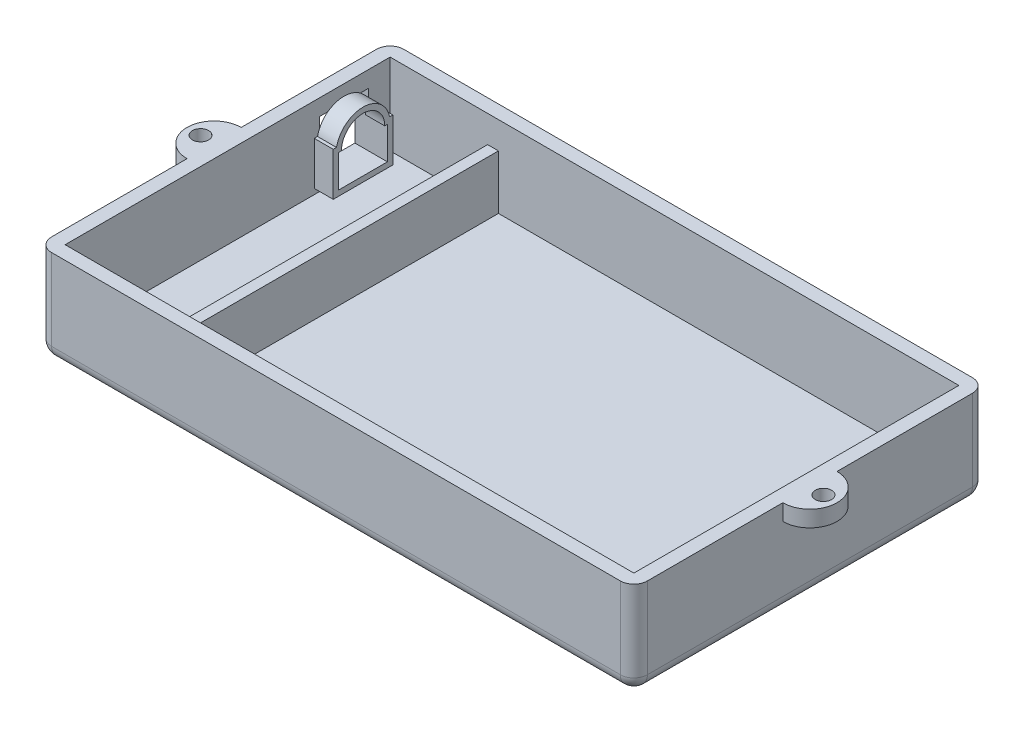
from build123d import *

# Parameters (mm, degrees)
SKETCH1_W           = 105
SKETCH1_H           = 60
BOSS_EXTRUDE1_DEPTH = 15
SHELL1_T            = 2.5
FILLET1_R           = 2.5
SKETCH3_R           = 1.5
BOSS_EXTRUDE2_DEPTH = 3
SKETCH4_W           = 2
SKETCH4_H           = 60
BOSS_EXTRUDE3_DEPTH = 10
BOSS_EXTRUDE4_DEPTH = 6
SKETCH7_W           = 9
SKETCH7_H           = 10
CUT_EXTRUDE1_DEPTH  = 2.5


with BuildPart() as part:
    # Sketch1 → Boss-Extrude1 (new body)
    with BuildSketch(Plane(origin=(0, 0, 0), x_dir=(1, 0, 0), z_dir=(0, 1, 0))):
        Rectangle(SKETCH1_W, SKETCH1_H)
    extrude(amount=BOSS_EXTRUDE1_DEPTH)

    # Shell1
    shell1_openings = [part.faces().sort_by_distance(p)[0] for p in [
        (0, 15, 0),
    ]]
    offset(amount=SHELL1_T, openings=shell1_openings, kind=Kind.INTERSECTION)

    # Fillet1
    # the kernel refuses this fillet: 2.5 mm, written as the material it takes off along each edge
    with BuildSketch(Plane(origin=(52.5, 0, -30), x_dir=(1, 0, 0), z_dir=(0, 0, -1))) as fillet1_piece_1_section:
        Polygon((0, 0), (FILLET1_R, 0), (FILLET1_R, FILLET1_R), (0, FILLET1_R), align=None)
    fillet1_piece_1 = extrude(amount=FILLET1_R, mode=Mode.PRIVATE)
    fillet1_piece_1 = fillet1_piece_1 - Plane(origin=(52.5, 0, -30), x_dir=(-0.7071067811865475, 0.7071067811865475, 0), z_dir=(0, 0, -1)) * Sphere(FILLET1_R, mode=Mode.PRIVATE)
    add(fillet1_piece_1, mode=Mode.SUBTRACT)
    with BuildSketch(Plane(origin=(-52.5, 0, -30), x_dir=(0, -1, 0), z_dir=(0, 0, -1))) as fillet1_piece_2_section:
        Polygon((0, 0), (FILLET1_R, 0), (FILLET1_R, FILLET1_R), (0, FILLET1_R), align=None)
    fillet1_piece_2 = extrude(amount=FILLET1_R, mode=Mode.PRIVATE)
    fillet1_piece_2 = fillet1_piece_2 - Plane(origin=(-52.5, 0, -30), x_dir=(0.7071067811865475, 0.7071067811865475, 0), z_dir=(0, 0, -1)) * Sphere(FILLET1_R, mode=Mode.PRIVATE)
    add(fillet1_piece_2, mode=Mode.SUBTRACT)
    with BuildSketch(Plane(origin=(52.5, 0, 30), x_dir=(0, -1, 0), z_dir=(1, 0, 0))) as fillet1_piece_3_section:
        Polygon((0, 0), (FILLET1_R, 0), (FILLET1_R, -FILLET1_R), (0, -FILLET1_R), align=None)
    fillet1_piece_3 = extrude(amount=FILLET1_R, mode=Mode.PRIVATE)
    fillet1_piece_3 = fillet1_piece_3 - Plane(origin=(52.5, 0, 30), x_dir=(0, 0.7071067811865475, -0.7071067811865475), z_dir=(1, 0, 0)) * Sphere(FILLET1_R, mode=Mode.PRIVATE)
    add(fillet1_piece_3, mode=Mode.SUBTRACT)
    with BuildSketch(Plane(origin=(-52.5, 0, 30), x_dir=(0, 0, 1), z_dir=(0, -1, 0))) as fillet1_piece_4_section:
        Polygon((0, 0), (FILLET1_R, 0), (FILLET1_R, FILLET1_R), (0, FILLET1_R), align=None)
    fillet1_piece_4 = extrude(amount=FILLET1_R, mode=Mode.PRIVATE)
    fillet1_piece_4 = fillet1_piece_4 - Plane(origin=(-52.5, 0, 30), x_dir=(0.7071067811865475, 0, -0.7071067811865476), z_dir=(0, -1, 0)) * Sphere(FILLET1_R, mode=Mode.PRIVATE)
    add(fillet1_piece_4, mode=Mode.SUBTRACT)
    with BuildSketch(Plane(origin=(52.5, -2.5, -32.5), x_dir=(0, 1, 0), z_dir=(-1, 0, 0)), Plane(origin=(-52.5, -2.5, 32.5), x_dir=(0, 1, 0), z_dir=(1, 0, 0))) as fillet1_piece_5:
        with BuildLine():
            CenterArc((FILLET1_R, -FILLET1_R), FILLET1_R, 90, 90)
            Line((0, -FILLET1_R), (0, 0))
            Line((0, 0), (FILLET1_R, 0))
        make_face()
    extrude(amount=105, mode=Mode.SUBTRACT)
    with BuildSketch(Plane(origin=(55, -2.5, 30), x_dir=(0, 1, 0), z_dir=(0, 0, -1)), Plane(origin=(-55, -2.5, -30), x_dir=(0, 1, 0), z_dir=(0, 0, 1))) as fillet1_piece_6:
        with BuildLine():
            CenterArc((FILLET1_R, -FILLET1_R), FILLET1_R, 90, 90)
            Line((0, -FILLET1_R), (0, 0))
            Line((0, 0), (FILLET1_R, 0))
        make_face()
    extrude(amount=60, mode=Mode.SUBTRACT)
    with BuildSketch(Plane(origin=(-55, 21.25, -32.5), x_dir=(0, 0, 1), z_dir=(0, -1, 0)), Plane(origin=(55, 21.25, -32.5), x_dir=(-1, 0, 0), z_dir=(0, -1, 0)), Plane(origin=(55, 0, 32.5), x_dir=(-1, 0, 0), z_dir=(0, 1, 0)), Plane(origin=(-55, 21.25, 32.5), x_dir=(1, 0, 0), z_dir=(0, -1, 0))) as fillet1_piece_7:
        with BuildLine():
            CenterArc((FILLET1_R, -FILLET1_R), FILLET1_R, 90, 90)
            Line((0, -FILLET1_R), (0, 0))
            Line((0, 0), (FILLET1_R, 0))
        make_face()
    extrude(amount=21.25, mode=Mode.SUBTRACT)

    # Sketch3 → Boss-Extrude2 (add)
    # profile 1 of 2: a face of its own
    with BuildSketch(Plane(origin=(0, 15, 0), x_dir=(1, 0, 0), z_dir=(0, 1, 0))):
        with BuildLine():
            Line((55, 5), (55, -5))
            ThreePointArc((55, -5), (60, 0), (55, 5))
        make_face()
        with Locations(Location((57.5, 0, 0), (0, 0, 270))):
            Circle(SKETCH3_R, mode=Mode.SUBTRACT)
    # profile 2 of 2: a face of its own
    with BuildSketch(Plane(origin=(0, 15, 0), x_dir=(1, 0, 0), z_dir=(0, 1, 0))):
        with BuildLine():
            ThreePointArc((-55, 5), (-60, 0), (-55, -5))
            Line((-55, -5), (-55, 5))
        make_face()
        with Locations(Location((-57.5, 0, 0), (0, 0, 270))):
            Circle(SKETCH3_R, mode=Mode.SUBTRACT)
    extrude(amount=-BOSS_EXTRUDE2_DEPTH)

    # Sketch4 → Boss-Extrude3 (add)
    with BuildSketch(Plane(origin=(0, 0, 0), x_dir=(1, 0, 0), z_dir=(0, 1, 0))):
        with Locations((-33.5, 0)):
            Rectangle(SKETCH4_W, SKETCH4_H)
    extrude(amount=BOSS_EXTRUDE3_DEPTH)

    # Sketch5 → Boss-Extrude4 (add)
    with BuildSketch(Plane.ZY.offset(55)):
        with BuildLine():
            Line((-27, 9), (-27, 1))
            Line((-27, 1), (-16, 1))
            Line((-16, 1), (-16, 9))
            Line((-16, 9), (-16.601020514, 9))
            ThreePointArc((-16.601020514, 9), (-21.5, 13), (-26.398979486, 9))
            Line((-26.398979486, 9), (-27, 9))
        make_face()
        with BuildLine():
            Line((-17.5, 8), (-17, 8))
            Line((-17, 8), (-17, 2))
            Line((-17, 2), (-26, 2))
            Line((-26, 2), (-26, 8))
            Line((-26, 8), (-25.5, 8))
            ThreePointArc((-25.5, 8), (-21.5, 12), (-17.5, 8))
        make_face(mode=Mode.SUBTRACT)
    extrude(amount=-BOSS_EXTRUDE4_DEPTH)

    # Sketch7 → Cut-Extrude1 (cut)
    with BuildSketch(Plane.ZY.offset(55)):
        with Locations((-21.5, 7)):
            Rectangle(SKETCH7_W, SKETCH7_H)
    extrude(amount=-CUT_EXTRUDE1_DEPTH, mode=Mode.SUBTRACT)


solid = part.part
